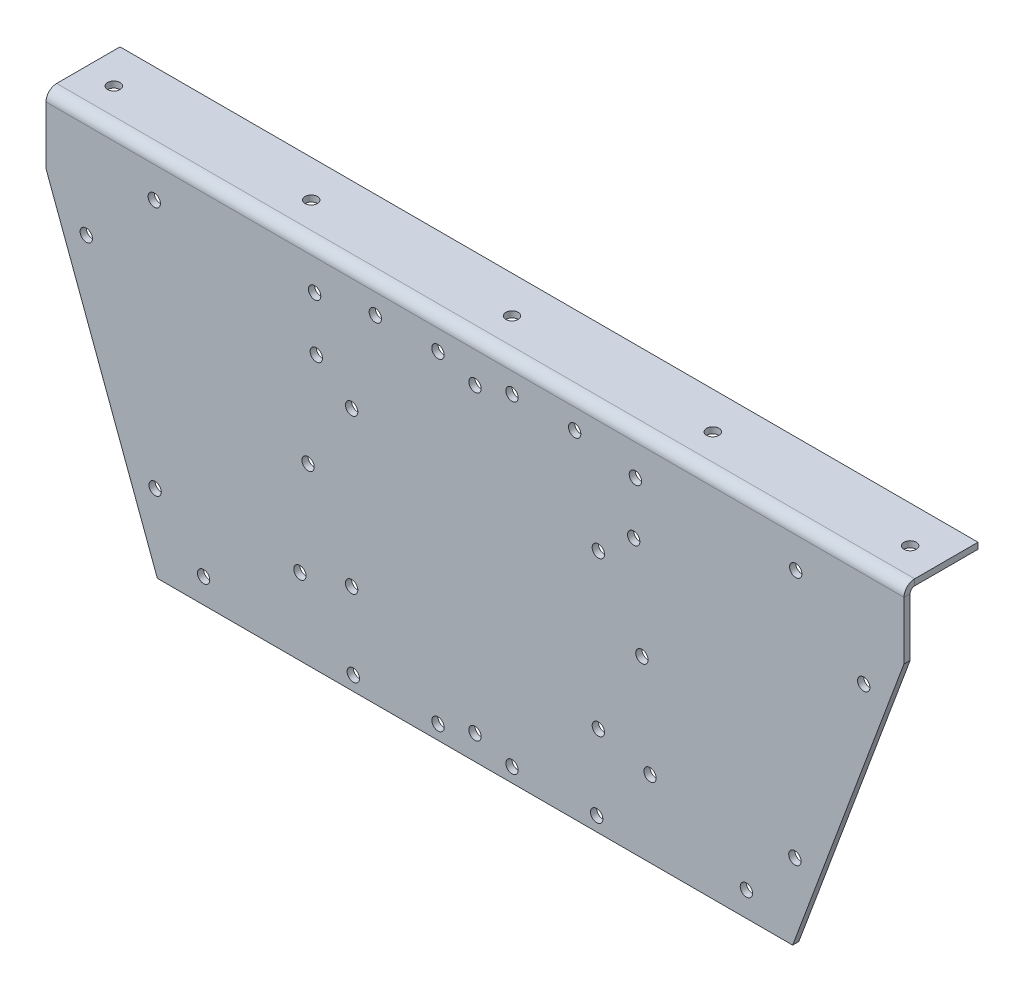
from build123d import *

# Parameters (mm, degrees)
SM_BASE_FLANGE_1_DEPTH           = 1
SM_EDGE_FLANGE_1_STRIP_W         = 5.4732
SM_EDGE_FLANGE_1_STRIP_H         = 1
SM_EDGE_FLANGE_1_STRIP_CUT_DEPTH = 139.1
SM_EDGE_FLANGE_1_DEPTH           = 139.1
SKETCH_7_R                       = 1
CUT_EXTRUDE_1_DEPTH              = 2
SKETCH_8_R                       = 1
CUT_EXTRUDE_2_DEPTH              = 2
SKETCH_9_R                       = 1
CUT_EXTRUDE_3_DEPTH              = 10
SKETCH_10_R                      = 1
CUT_EXTRUDE_4_DEPTH              = 10
SKETCH_11_R                      = 1
CUT_EXTRUDE_5_DEPTH              = 81.928131697
SKETCH_12_R                      = 1
CUT_EXTRUDE_6_DEPTH              = 10


# Sheet-metal steps are written as plain solids
with BuildPart() as part:
    # Sketch 1 → 基材-凸緣1 (new body)
    with BuildSketch(Plane.XY):
        Polygon((-69.55, 38.6), (69.55, 38.6), (69.55, 28.5), (51.5, -20), (-51.5, -20), (-69.55, 28.5), align=None)
    extrude(amount=-SM_BASE_FLANGE_1_DEPTH)

    # 邊線-凸緣1 strip (across the edge) → 邊線-凸緣1 strip cut (cut)
    with BuildSketch(Plane(origin=(-69.55, 38.6, -1), x_dir=(0, -1, 0), z_dir=(1, 0, 0))):
        with Locations((-2, -0.5)):
            Rectangle(SM_EDGE_FLANGE_1_STRIP_W, SM_EDGE_FLANGE_1_STRIP_H)
    extrude(amount=SM_EDGE_FLANGE_1_STRIP_CUT_DEPTH, mode=Mode.SUBTRACT)

    # 邊線-凸緣1 section (across the edge) → 邊線-凸緣1 (add)
    with BuildSketch(Plane(origin=(-69.55, 38.6, -1), x_dir=(0, -1, 0), z_dir=(1, 0, 0))):
        with BuildLine():
            Line((-1, 0.7366), (-1, 11))
            Line((-1, 11), (0, 11))
            Line((0, 11), (0, 0.7366))
            ThreePointArc((0, 0.7366), (0.215745145, 0.215745145), (0.7366, 0))
            Line((0.7366, 0), (0.7366, -1))
            ThreePointArc((0.7366, -1), (-0.491361636, -0.491361636), (-1, 0.7366))
        make_face()
    extrude(amount=SM_EDGE_FLANGE_1_DEPTH)

    # 草圖7 → 除料-伸長1 (cut)
    with BuildSketch(Plane.XY):
        with Locations((0, 32.8634)):
            Circle(SKETCH_7_R)
        with Locations((0, -16)):
            Circle(SKETCH_7_R)
        with Locations((52, 32.8634)):
            Circle(SKETCH_7_R)
        with Locations((26, 32.8634)):
            Circle(SKETCH_7_R)
        with Locations((-52, 32.8634)):
            Circle(SKETCH_7_R)
        with Locations((-26, 32.8634)):
            Circle(SKETCH_7_R)
        with Locations((-63.021136316, 22.425192514)):
            Circle(SKETCH_7_R)
        with Locations((-51.859762821, -7.565201643)):
            Circle(SKETCH_7_R)
        with Locations((51.859762821, -7.565201643)):
            Circle(SKETCH_7_R)
        with Locations((63.021136316, 22.425192514)):
            Circle(SKETCH_7_R)
        with Locations((44, -16)):
            Circle(SKETCH_7_R)
        with Locations((-44, -16)):
            Circle(SKETCH_7_R)
    extrude(amount=-CUT_EXTRUDE_1_DEPTH, mode=Mode.SUBTRACT)

    # 草圖8 → 除料-伸長2 (cut)
    with BuildSketch(Plane(origin=(0, 39.6, 0), x_dir=(1, 0, 0), z_dir=(0, 1, 0))):
        with Locations(Location((0, 6, 0), (0, 0, 270))):
            Circle(SKETCH_8_R)
        with Locations(Location((64.55, 6, 0), (0, 0, 270))):
            Circle(SKETCH_8_R)
        with Locations(Location((-64.55, 6, 0), (0, 0, 270))):
            Circle(SKETCH_8_R)
        with Locations(Location((-32.55, 6, 0), (0, 0, 270))):
            Circle(SKETCH_8_R)
        with Locations(Location((32.55, 6, 0), (0, 0, 270))):
            Circle(SKETCH_8_R)
    extrude(amount=-CUT_EXTRUDE_2_DEPTH, mode=Mode.SUBTRACT)

    # 草圖9 → 除料-伸長3 (cut)
    with BuildSketch(Plane.XY):
        with Locations((-6, 34.6)):
            Circle(SKETCH_9_R)
        with Locations((-16.16, 34.6)):
            Circle(SKETCH_9_R)
        with Locations(Location((16.16, 34.6, 0), (0, 0, 180))):
            Circle(SKETCH_9_R)
        with Locations(Location((6, 34.6, 0), (0, 0, 180))):
            Circle(SKETCH_9_R)
    extrude(amount=-CUT_EXTRUDE_3_DEPTH, mode=Mode.SUBTRACT)

    # 草圖10 → 除料-伸長4 (cut)
    with BuildSketch(Plane.XY):
        with Locations((-20, 19.6)):
            Circle(SKETCH_10_R)
        with Locations((20, 19.6)):
            Circle(SKETCH_10_R)
        with Locations((20, -5.4)):
            Circle(SKETCH_10_R)
        with Locations((-20, -5.4)):
            Circle(SKETCH_10_R)
    extrude(amount=-CUT_EXTRUDE_4_DEPTH, mode=Mode.SUBTRACT)

    # 草圖11 → 除料-伸長5 (cut, through all)
    with BuildSketch(Plane.XY):
        with Locations((19.73, -17.69)):
            Circle(SKETCH_11_R)
        with Locations((6, -17.69)):
            Circle(SKETCH_11_R)
        with Locations(Location((-19.73, -17.69, 0), (0, 0, 180))):
            Circle(SKETCH_11_R)
        with Locations(Location((-6, -17.69, 0), (0, 0, 180))):
            Circle(SKETCH_11_R)
    extrude(amount=-CUT_EXTRUDE_5_DEPTH, mode=Mode.SUBTRACT)

    # 草圖12 → 除料-伸長6 (cut)
    with BuildSketch(Plane.XY):
        with Locations((25.73, 24.27)):
            Circle(SKETCH_12_R)
        with Locations((27.06, 8.32)):
            Circle(SKETCH_12_R)
        with Locations((28.38, -7.62)):
            Circle(SKETCH_12_R)
    cut_extrude_6 = extrude(amount=-CUT_EXTRUDE_6_DEPTH, mode=Mode.SUBTRACT)

    # 鏡射1: 除料-伸長6 across plane
    add(cut_extrude_6.mirror(Plane(origin=(0, 0, 0), x_dir=(0, 0, 1), z_dir=(1, 0, 0))), mode=Mode.SUBTRACT)


solid = part.part
